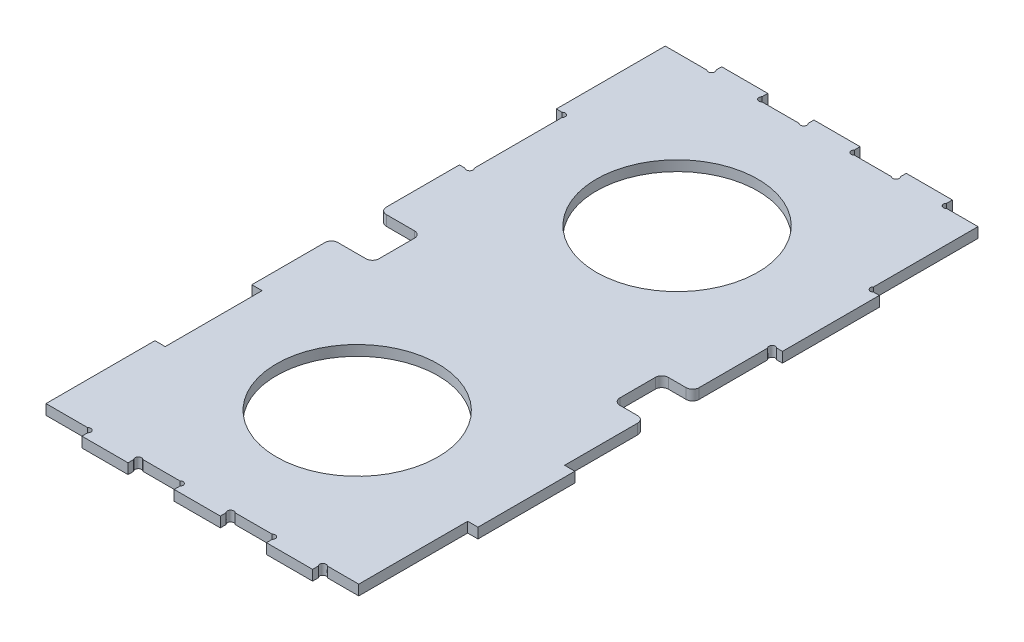
from build123d import *

# Parameters (mm, degrees)
SKETCH1_W                 = 100
SKETCH1_H                 = 198.069
BOSS_EXTRUDE1_DEPTH       = 3.175
SKETCH2_W                 = 14.285714286
SKETCH2_H                 = 3.18
ENDSLOTS_DEPTH            = 111.986092891
GIVEUPCORNER_DEPTH        = 111.986092891
GIVEUPCORNER_DEPTH_BACK   = 111.986092891
SKETCH6_W                 = 3.18
SKETCH6_H                 = 194.889
SKETCH3_W                 = 3.18
SKETCH3_H                 = 30
BOSS_EXTRUDE2_DEPTH       = 3.175
SKETCH4_W                 = 3.18
SKETCH4_H                 = 30
CUT_EXTRUDE2_DEPTH        = 111.986092891
SKETCH7_R                 = 1
CUT_EXTRUDE5_DEPTH        = 111.986092891
SKETCH_PATTERN1_DEPTH     = 3.175
CUT_EXTRUDE6_DEPTH        = 111.986092891
CUT_EXTRUDE6_DEPTH_BACK   = 111.986092891
SKETCH9_R                 = 1
SKETCH10_R                = 25
WEIGHTCUTOUT_DEPTH        = 111.986092891
ZSYMMETRY_COPY_1_SKETCH_R = 1
ZSYMMETRY_COPY_1_DEPTH    = 111.986092891
ZSYMMETRY_COPY_2_DEPTH    = 3.175
ZIPTIESLOTS_DEPTH         = 111.986092891
ZIPTIESLOTS_DEPTH_BACK    = 111.986092891
SKETCH5_W                 = 9.525
SKETCH5_H                 = 15
SKETCH5_W_2               = 12.705
FILLET1_R                 = 2


# Read off the part's stored shape, not the designer's step: Sketch-Pattern1
with BuildPart() as part:
    # Sketch1 → Boss-Extrude1 (new body)
    with BuildSketch(Plane(origin=(0, 0, 0), x_dir=(1, 0, 0), z_dir=(0, 1, 0))):
        Rectangle(SKETCH1_W, SKETCH1_H)
    extrude(amount=BOSS_EXTRUDE1_DEPTH)

    # Sketch2 → endSlots (cut, symmetric)
    with BuildSketch(Plane(origin=(0, 3.175, 0), x_dir=(1, 0, 0), z_dir=(0, 1, 0))):
        with Locations((-42.857142857, 97.4445)):
            Rectangle(SKETCH2_W, SKETCH2_H)
        with Locations((-14.285714286, 97.4445)):
            Rectangle(SKETCH2_W, SKETCH2_H)
        with Locations((14.285714286, 97.4445)):
            Rectangle(SKETCH2_W, SKETCH2_H)
        with Locations((42.857142857, 97.4445)):
            Rectangle(SKETCH2_W, SKETCH2_H)
    endslots = extrude(amount=ENDSLOTS_DEPTH, both=True, mode=Mode.SUBTRACT)

    # Sketch6 → giveUpCorner (cut, two sides: drawn at the far end of the back side and taken through both)
    with BuildSketch(Plane(origin=(0, 3.175, 0), x_dir=(1, 0, 0), z_dir=(0, 1, 0)).offset(-GIVEUPCORNER_DEPTH_BACK)):
        with Locations((48.41, -1.59)):
            Rectangle(SKETCH6_W, SKETCH6_H)
    extrude(amount=GIVEUPCORNER_DEPTH + GIVEUPCORNER_DEPTH_BACK, mode=Mode.SUBTRACT)

    # Sketch3 → Boss-Extrude2 (add)
    with BuildSketch(Plane(origin=(0, 3.175, 0), x_dir=(1, 0, 0), z_dir=(0, 1, 0))):
        with Locations((48.41, 47.13225)):
            Rectangle(SKETCH3_W, SKETCH3_H)
    boss_extrude2 = extrude(amount=-BOSS_EXTRUDE2_DEPTH)

    # Sketch4 → Cut-Extrude2 (cut, symmetric)
    with BuildSketch(Plane(origin=(0, 3.175, 0), x_dir=(1, 0, 0), z_dir=(0, 1, 0))):
        with Locations((-48.41, 47.13225)):
            Rectangle(SKETCH4_W, SKETCH4_H)
    cut_extrude2 = extrude(amount=CUT_EXTRUDE2_DEPTH, both=True, mode=Mode.SUBTRACT)

    # Sketch7 → Cut-Extrude5 (cut, symmetric)
    with BuildSketch(Plane(origin=(0, 3.175, 0), x_dir=(1, 0, 0), z_dir=(0, 1, 0))):
        with Locations((-36.421392495, 96.561606781)):
            Circle(SKETCH7_R)
    cut_extrude5 = extrude(amount=CUT_EXTRUDE5_DEPTH, both=True, mode=Mode.SUBTRACT)

    # Sketch-Pattern1 outline → Sketch-Pattern1 (cut)
    with BuildSketch(Plane(origin=(0, 0, 0), x_dir=(1, 0, 0), z_dir=(0, 1, 0))):
        with BuildLine():
            Line((-7.142857143, 95.8545), (-8.557070705, 95.8545))
            ThreePointArc((-8.557070705, 95.8545), (-7.849963924, 95.561606781), (-7.142857143, 95.8545))
        make_face()
        with BuildLine():
            Line((-7.142857143, 97.268713562), (-7.142857143, 95.8545))
            ThreePointArc((-7.142857143, 95.8545), (-6.849963924, 96.561606781), (-7.142857143, 97.268713562))
        make_face()
        with BuildLine():
            Line((21.428571429, 95.8545), (20.014357866, 95.8545))
            ThreePointArc((20.014357866, 95.8545), (20.721464647, 95.561606781), (21.428571429, 95.8545))
        make_face()
        with BuildLine():
            Line((21.428571429, 97.268713562), (21.428571429, 95.8545))
            ThreePointArc((21.428571429, 95.8545), (21.721464648, 96.561606781), (21.428571429, 97.268713562))
        make_face()
    sketch_pattern1 = extrude(amount=SKETCH_PATTERN1_DEPTH, mode=Mode.SUBTRACT)

    # Mirror3: Cut-Extrude5, Sketch-Pattern1 across plane
    add(cut_extrude5.mirror(Plane(origin=(0, 0, 0), x_dir=(0, 0, 1), z_dir=(1, 0, 0))), mode=Mode.SUBTRACT)
    add(sketch_pattern1.mirror(Plane(origin=(0, 0, 0), x_dir=(0, 0, 1), z_dir=(1, 0, 0))), mode=Mode.SUBTRACT)

    # Sketch9 → Cut-Extrude6 (cut, two sides: drawn at the far end of the back side and taken through both)
    with BuildSketch(Plane(origin=(0, 3.175, 0), x_dir=(1, 0, 0), z_dir=(0, 1, 0)).offset(-CUT_EXTRUDE6_DEPTH_BACK)):
        with Locations((-47.527106781, 61.425143219)):
            Circle(SKETCH9_R)
        with Locations((47.527106781, 31.425143219)):
            Circle(SKETCH9_R)
        with Locations((47.527106781, 62.839356781)):
            Circle(SKETCH9_R)
        with Locations((-47.527106781, 32.839356781)):
            Circle(SKETCH9_R)
    extrude(amount=CUT_EXTRUDE6_DEPTH + CUT_EXTRUDE6_DEPTH_BACK, mode=Mode.SUBTRACT)

    # Sketch10 → weightCutout (cut, symmetric)
    with BuildSketch(Plane(origin=(0, 3.175, 0), x_dir=(1, 0, 0), z_dir=(0, 1, 0))):
        with Locations(Location((0, 49.51725, 0), (0, 0, 270))):
            Circle(SKETCH10_R)
    weightcutout = extrude(amount=WEIGHTCUTOUT_DEPTH, both=True, mode=Mode.SUBTRACT)

    # zSymmetry: endSlots, Boss-Extrude2, Cut-Extrude2, Cut-Extrude5, Sketch-Pattern1, weightCutout across plane
    add(endslots.mirror(Plane.XY), mode=Mode.SUBTRACT)
    add(boss_extrude2.mirror(Plane.XY))
    add(cut_extrude2.mirror(Plane.XY), mode=Mode.SUBTRACT)
    add(cut_extrude5.mirror(Plane.XY), mode=Mode.SUBTRACT)
    add(sketch_pattern1.mirror(Plane.XY), mode=Mode.SUBTRACT)
    add(weightcutout.mirror(Plane.XY), mode=Mode.SUBTRACT)

    # zSymmetry copy 1 sketch → zSymmetry copy 1 (cut, symmetric)
    with BuildSketch(Plane(origin=(0, 3.175, 0), x_dir=(-1, 0, 0), z_dir=(0, 1, 0))):
        with Locations((-36.421392495, 96.561606781)):
            Circle(ZSYMMETRY_COPY_1_SKETCH_R)
    extrude(amount=ZSYMMETRY_COPY_1_DEPTH, both=True, mode=Mode.SUBTRACT)

    # zSymmetry copy 2 sketch → zSymmetry copy 2 (cut)
    with BuildSketch(Plane(origin=(0, 0, 0), x_dir=(-1, 0, 0), z_dir=(0, 1, 0))):
        with BuildLine():
            Line((-7.142857143, 95.8545), (-8.557070705, 95.8545))
            ThreePointArc((-8.557070705, 95.8545), (-7.849963924, 95.561606781), (-7.142857143, 95.8545))
        make_face()
        with BuildLine():
            Line((-7.142857143, 97.268713562), (-7.142857143, 95.8545))
            ThreePointArc((-7.142857143, 95.8545), (-6.849963924, 96.561606781), (-7.142857143, 97.268713562))
        make_face()
        with BuildLine():
            Line((21.428571429, 95.8545), (20.014357866, 95.8545))
            ThreePointArc((20.014357866, 95.8545), (20.721464647, 95.561606781), (21.428571429, 95.8545))
        make_face()
        with BuildLine():
            Line((21.428571429, 97.268713562), (21.428571429, 95.8545))
            ThreePointArc((21.428571429, 95.8545), (21.721464648, 96.561606781), (21.428571429, 97.268713562))
        make_face()
    extrude(amount=ZSYMMETRY_COPY_2_DEPTH, mode=Mode.SUBTRACT)

    # Sketch5 → zipTieSlots (cut, two sides: drawn at the far end of the back side and taken through both)
    with BuildSketch(Plane(origin=(0, 3.175, 0), x_dir=(1, 0, 0), z_dir=(0, 1, 0)).offset(-ZIPTIESLOTS_DEPTH_BACK)):
        with Locations((42.0575, 0)):
            Rectangle(SKETCH5_W, SKETCH5_H)
        with Locations((-43.6475, 0)):
            Rectangle(SKETCH5_W_2, SKETCH5_H)
    extrude(amount=ZIPTIESLOTS_DEPTH + ZIPTIESLOTS_DEPTH_BACK, mode=Mode.SUBTRACT)

    # Fillet1
    fillet1_edges = [part.edges().sort_by_distance(p)[0] for p in [
        (46.82, 1.5875, -7.5),
        (46.82, 1.5875, 7.5),
        (37.295, 1.5875, 7.5),
        (37.295, 1.5875, -7.5),
        (-50, 1.5875, 7.5),
        (-50, 1.5875, -7.5),
        (-37.295, 1.5875, -7.5),
        (-37.295, 1.5875, 7.5),
    ]]
    fillet(fillet1_edges, radius=FILLET1_R)


solid = part.part
